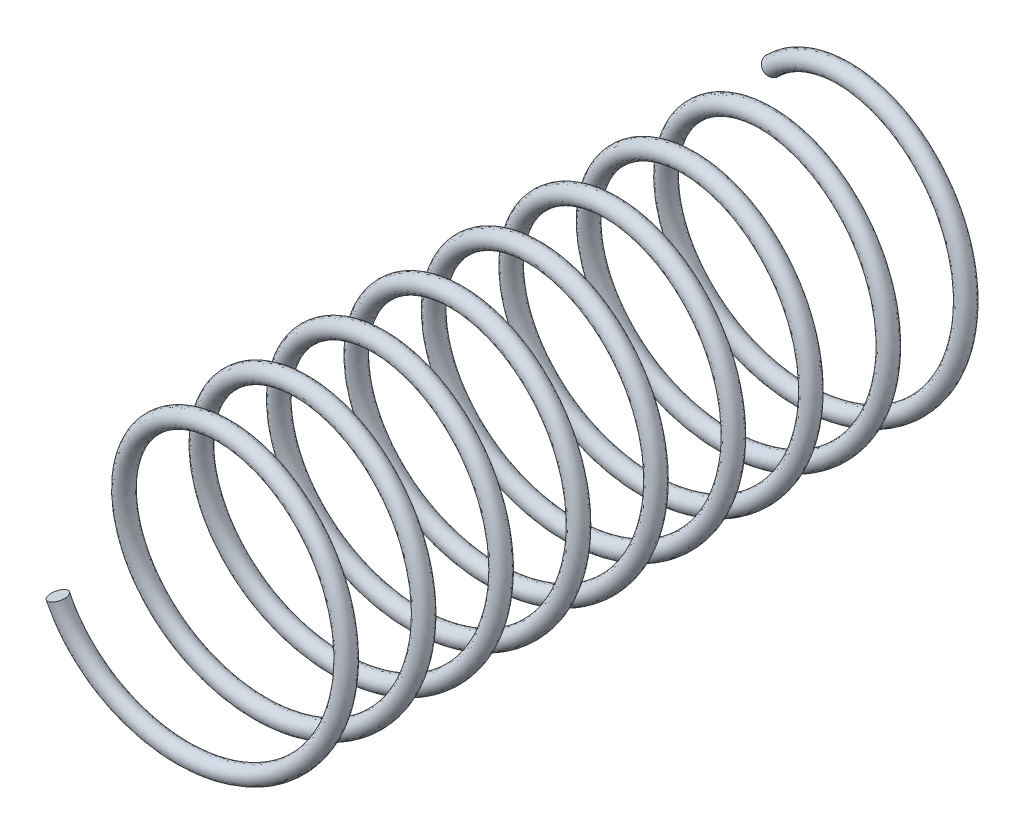
from build123d import *

# Parameters (mm, degrees)
SWEEP1_PITCH       = 4.318
SWEEP1_HEIGHT      = 38.1
SWEEP1_RADIUS      = 7.239
SWEEP1_START_ANGLE = 135
SWEEP1_PROFILE_R   = 0.48895


with BuildPart() as part:
    # Sweep1: sweep along a helix
    with BuildLine() as sweep1_path:
        add(Helix(SWEEP1_PITCH, SWEEP1_HEIGHT, SWEEP1_RADIUS, center=(0, 0, 0), direction=(0, 0, 1), lefthand=True, mode=Mode.PRIVATE).rotate(Axis((0, 0, 0), (0, 0, 1)), SWEEP1_START_ANGLE))
    # Sweep1 profile (on start of the path) → Sweep1 (sweep)
    with BuildSketch(Plane(origin=(-5.118745989, 5.118745989, 0), x_dir=(0.7071067811866028, -0.7071067811864925, 0), z_dir=(0.7039417363306364, 0.7039417363307461, 0.0945095958274261))):
        Circle(SWEEP1_PROFILE_R)
    sweep(path=sweep1_path.line, is_frenet=True)


solid = part.part
